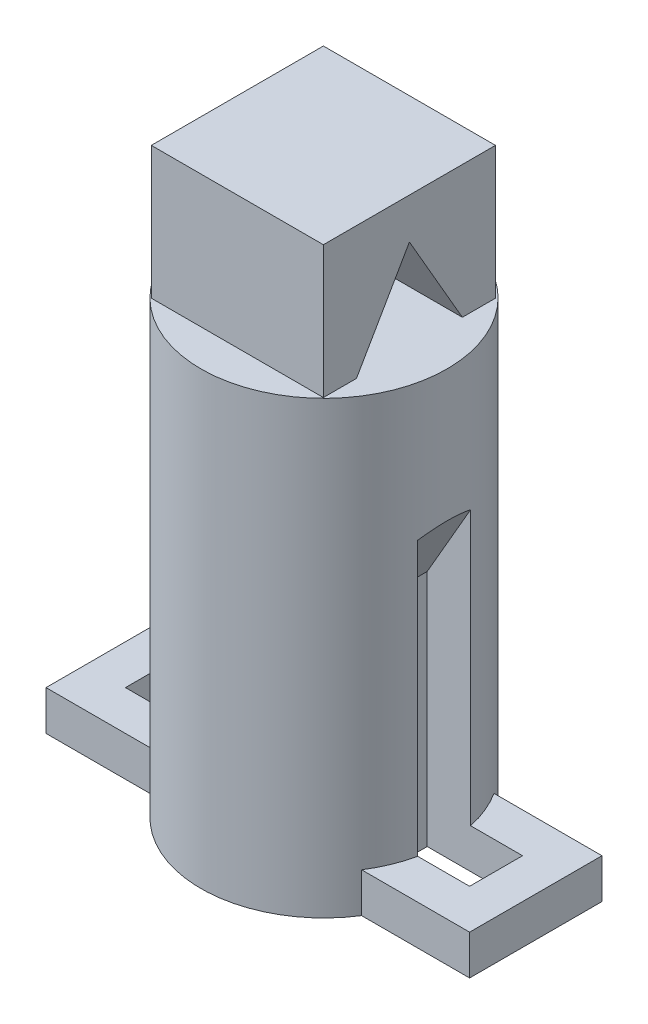
from build123d import *

# Parameters (mm, degrees)
SKETCH1_W               = 13
SKETCH1_H               = 13
BOSS_EXTRUDE1_DEPTH     = 10
SKETCH2_R               = 9.3
BOSS_EXTRUDE2_DEPTH     = 34
SKETCH3_W               = 32
SKETCH3_H               = 10
SKETCH3_W_2             = 7.2
SKETCH3_H_2             = 4
BOSS_EXTRUDE3_DEPTH     = 3
CUT_EXTRUDE1_DEPTH      = 42.817938734
CUT_EXTRUDE1_DEPTH_BACK = 42.817938734
SKETCH5_W               = 7.2
SKETCH5_H               = 4
CUT_EXTRUDE2_DEPTH      = 25
CHAMFER1_SIZE           = 7
CHAMFER1_SIZE_2         = 4.041451884


with BuildPart() as part:
    # Sketch1 → Boss-Extrude1 (new body)
    with BuildSketch(Plane(origin=(0, 0, 0), x_dir=(1, 0, 0), z_dir=(0, 1, 0))):
        with Locations((0, -0.046937875)):
            Rectangle(SKETCH1_W, SKETCH1_H)
    extrude(amount=BOSS_EXTRUDE1_DEPTH)

    # Sketch2 → Boss-Extrude2 (add)
    with BuildSketch(Plane.XZ):
        with Locations(Location((0, 0, 0), (0, 0, 270))):
            Circle(SKETCH2_R)
    extrude(amount=BOSS_EXTRUDE2_DEPTH)

    # Sketch3 → Boss-Extrude3 (add)
    with BuildSketch(Plane.XZ.offset(34)):
        Rectangle(SKETCH3_W, SKETCH3_H)
        with Locations((-9.4, 0)):
            Rectangle(SKETCH3_W_2, SKETCH3_H_2, mode=Mode.SUBTRACT)
        with Locations((9.4, 0)):
            Rectangle(SKETCH3_W_2, SKETCH3_H_2, mode=Mode.SUBTRACT)
    extrude(amount=-BOSS_EXTRUDE3_DEPTH)

    # Sketch4 → Cut-Extrude1 (cut, two sides: drawn at the far end of the back side and taken through both)
    with BuildSketch(Plane.ZY.offset(6.5).offset(-CUT_EXTRUDE1_DEPTH_BACK)):
        Polygon((-3.953062125, 0), (4.046937875, 0), (0.046937875, 6.92820323), align=None)
    extrude(amount=CUT_EXTRUDE1_DEPTH + CUT_EXTRUDE1_DEPTH_BACK, mode=Mode.SUBTRACT)

    # Sketch5 → Cut-Extrude2 (cut)
    with BuildSketch(Plane.XZ.offset(34)):
        with Locations((-9.4, 0)):
            Rectangle(SKETCH5_W, SKETCH5_H)
        with Locations((9.4, 0)):
            Rectangle(SKETCH5_W, SKETCH5_H)
    extrude(amount=-CUT_EXTRUDE2_DEPTH, mode=Mode.SUBTRACT)

    # Chamfer1
    # the kernel refuses this chamfer: 7, 4.041451884 mm, written as the material it adds along each edge
    with BuildSketch(Plane(origin=(-5.8, -9, -20.109600283), x_dir=(0.01932676561270078, -0.9998132206222078, 0), z_dir=(0, 0, 1))) as chamfer1_piece_1_section:
        Polygon((CHAMFER1_SIZE * 0.999813220622, -CHAMFER1_SIZE * 0.0193267656127), (-CHAMFER1_SIZE_2 * 0.0193267656143, -CHAMFER1_SIZE_2 * 0.999813220703), (0, 0), align=None)
    chamfer1_piece_1 = extrude(amount=40.219200565, mode=Mode.PRIVATE)
    chamfer1_piece_1 = chamfer1_piece_1 & Plane(origin=(0, -11.718976522, 0), x_dir=(0, 0, -1), z_dir=(0, 1, 0)) * Cylinder(9.3, 109, mode=Mode.PRIVATE)
    add(chamfer1_piece_1)
    with BuildSketch(Plane(origin=(5.8, -9, 20.109600283), x_dir=(-0.01932676561270078, -0.9998132206222078, 0), z_dir=(0, 0, -1))) as chamfer1_piece_2_section:
        Polygon((CHAMFER1_SIZE * 0.999813220622, -CHAMFER1_SIZE * 0.0193267656127), (-CHAMFER1_SIZE_2 * 0.0193267656143, -CHAMFER1_SIZE_2 * 0.999813220703), (0, 0), align=None)
    chamfer1_piece_2 = extrude(amount=40.219200565, mode=Mode.PRIVATE)
    chamfer1_piece_2 = chamfer1_piece_2 & Plane(origin=(0, -11.718976523, 0), x_dir=(0, 0, -1), z_dir=(0, 1, 0)) * Cylinder(9.3, 109, mode=Mode.PRIVATE)
    add(chamfer1_piece_2)


solid = part.part
